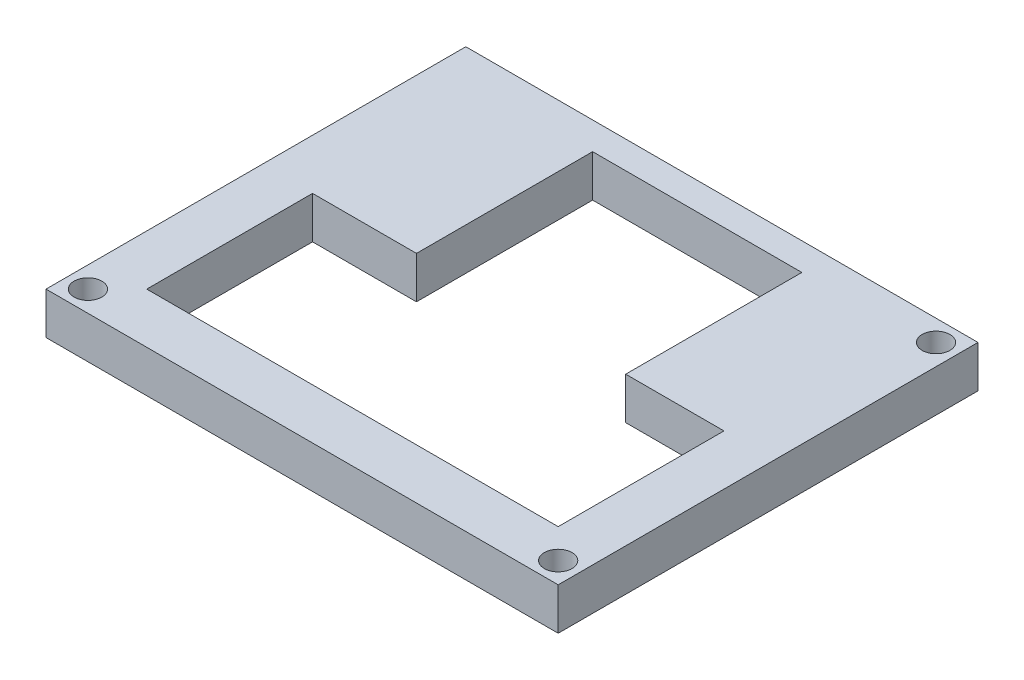
from build123d import *

# Parameters (mm, degrees)
SKETCH1_W           = 77.47
SKETCH1_H           = 63.5
BOSS_EXTRUDE1_DEPTH = 6.35
SKETCH2_R           = 2.1
CUT_EXTRUDE1_DEPTH  = 6.35


with BuildPart() as part:
    # Sketch1 → Boss-Extrude1 (new body)
    with BuildSketch(Plane(origin=(0, 0, 0), x_dir=(1, 0, 0), z_dir=(0, 1, 0))):
        with Locations((38.735, 31.75)):
            Rectangle(SKETCH1_W, SKETCH1_H)
        Polygon((23.33761346, 32.697540577), (23.33761346, 59.344124755), (54.982420655, 59.344124755), (54.982420655, 32.697540577), (69.85, 32.697540577), (69.85, 7.62), (7.62, 7.62), (7.62, 32.697540577), align=None, mode=Mode.SUBTRACT)
    extrude(amount=BOSS_EXTRUDE1_DEPTH)

    # Sketch2 → Cut-Extrude1 (cut)
    with BuildSketch(Plane(origin=(0, 6.35, 0), x_dir=(1, 0, 0), z_dir=(0, 1, 0))):
        with Locations((3.175, 3.175)):
            Circle(SKETCH2_R)
        with Locations((74.295, 3.175)):
            Circle(SKETCH2_R)
        with Locations((74.295, 60.325)):
            Circle(SKETCH2_R)
    extrude(amount=-CUT_EXTRUDE1_DEPTH, mode=Mode.SUBTRACT)


solid = part.part
